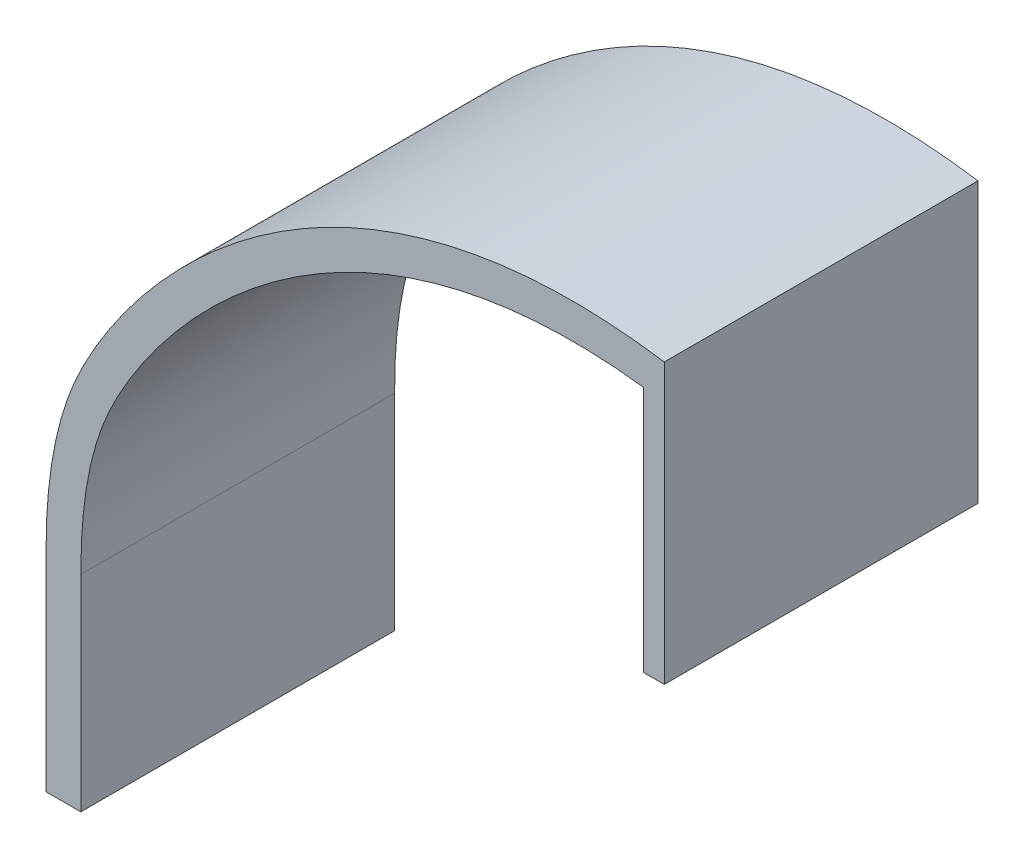
from build123d import *

# Parameters (mm, degrees)
BOSS_EXTRUDE1_DEPTH = 22.5
BOSS_EXTRUDE2_DEPTH = 2.5


with BuildPart() as part:
    # Sketch2 → Boss-Extrude1 (new, symmetric)
    with BuildSketch(Plane.XY):
        with BuildLine():
            Line((-5, 0), (0, 0))
            Line((0, 0), (0, 29.5))
            add(Edge.make_bspline(
                [(0, 29.5), (0, 33.656366005), (0.251959436, 42.195490378), (8.39239071, 63.521119713), (37.61006661, 98.45987652), (80.68, 93.093413496)],
                knots=[0, 0, 0, 0, 0.310313233, 0.410313233, 0.986745027, 0.986745027, 0.986745027, 0.986745027], degree=3))
            Line((80.68, 93.093413496), (80.68, 57.666861105))
            Line((80.68, 57.666861105), (83.68, 57.666861105))
            Line((83.68, 57.666861105), (83.68, 97.726764997))
            add(Edge.make_bspline(
                [(-5, 29.5), (-5, 29.723870237), (-4.998998471, 30.161875494), (-4.991214438, 31.11575005), (-4.967293203, 32.393098024), (-4.905130079, 34.063055256), (-4.762963565, 36.447359928), (-4.447497152, 39.689713965), (-3.753430687, 43.906000266), (-2.663283078, 48.309535401), (-1.020453498, 52.934956275), (1.64260542, 58.233519424), (5.555270044, 64.384419703), (10.727422319, 70.998584458), (17.199357595, 77.728642436), (25.000612773, 84.186737899), (34.159093791, 89.974069876), (44.689534273, 94.674267104), (54.599442956, 97.330249906), (63.188474964, 98.48961435), (69.950584403, 98.827300678), (75.855470815, 98.624151441), (80.398685744, 98.182328038), (82.626999024, 97.884683206), (83.614455686, 97.736661645), (83.68, 97.726764997)],
                knots=[0, 0, 0, 0, 0.015625, 0.03125, 0.0625, 0.09375, 0.125, 0.1875, 0.25, 0.3125, 0.375, 0.4375, 0.5, 0.5625, 0.625, 0.6875, 0.75, 0.8125, 0.875, 0.90625, 0.9375, 0.96875, 0.984375, 0.995906803, 0.996725443, 0.996725443, 0.996725443, 0.996725443], degree=3))
            Line((-5, 29.5), (-5, 0))
        make_face()
    extrude(amount=BOSS_EXTRUDE1_DEPTH, both=True)

    # Sketch3 → Boss-Extrude2 (add, symmetric)
    with BuildSketch(Plane.XY):
        with BuildLine():
            Line((80.68, 75.380137301), (80.68, 93.093413496))
            add(Edge.make_bspline(
                [(53.331821293, 91.7069946), (61.45457156, 93.676076633), (70.566286605, 94.353570285), (80.68, 93.093413496)],
                knots=[0.85138689, 0.85138689, 0.85138689, 0.85138689, 0.986745027, 0.986745027, 0.986745027, 0.986745027], degree=3))
            Line((53.331821293, 91.7069946), (80.68, 75.380137301))
        make_face()
        with BuildLine():
            add(Edge.make_bspline(
                [(65.928247342, 90.173298548), (66.16699696, 92.186936313), (76.548452452, 93.293934857), (80.182394532, 81.982666958), (74.643822657, 83.250840349), (65.658403794, 87.897411524), (65.928247342, 90.173298548)],
                knots=[0, 0, 0, 0, 0.341183253, 0.548500538, 0.614382213, 1, 1, 1, 1], degree=3))
        make_face(mode=Mode.SUBTRACT)
    extrude(amount=BOSS_EXTRUDE2_DEPTH, both=True)


solid = part.part
